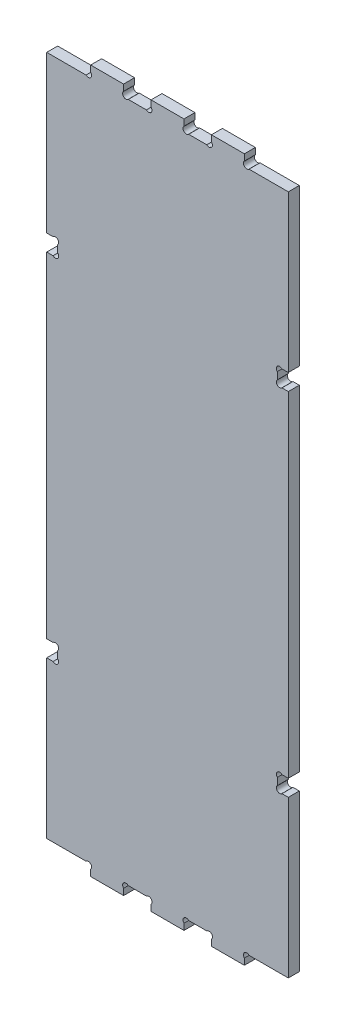
from build123d import *

# Parameters (mm, degrees)
SKETCH3_W           = 220
SKETCH3_H           = 640
BOSS_EXTRUDE1_DEPTH = 10
SKETCH4_W           = 40
SKETCH4_H           = 10
SKETCH4_W_2         = 25
CUT_EXTRUDE1_DEPTH  = 18
CAVITY1_START       = -75.965089032
CAVITY1_OUTLINE_W   = 10
CAVITY1_OUTLINE_H   = 10
CAVITY1_DEPTH       = 15
CAVITY1_START_2     = 244.034910968
CAVITY1_2_OUTLINE_W = 10
CAVITY1_2_OUTLINE_H = 10
CAVITY1_2_DEPTH     = 15
SKETCH7_R           = 3
CUT_EXTRUDE4_DEPTH  = 10


# Read off the part's stored shape, not the designer's step: Cavity1
with BuildPart() as part:
    # Sketch3 → Boss-Extrude1 (new body)
    with BuildSketch(Plane.XY):
        with Locations((-138.639194455, 91.534910968)):
            Rectangle(SKETCH3_W, SKETCH3_H)
    extrude(amount=BOSS_EXTRUDE1_DEPTH)

    # Sketch4 → Cut-Extrude1 (cut)
    with BuildSketch(Plane.XY.offset(10)):
        with Locations((-228.639194455, 406.534910968)):
            Rectangle(SKETCH4_W, SKETCH4_H)
        with Locations((-166.139194455, 406.534910968)):
            Rectangle(SKETCH4_W_2, SKETCH4_H)
        with Locations((-111.139194455, 406.534910968)):
            Rectangle(SKETCH4_W_2, SKETCH4_H)
        with Locations((-48.639194455, 406.534910968)):
            Rectangle(SKETCH4_W, SKETCH4_H)
        with Locations((-48.639194455, -223.465089032)):
            Rectangle(SKETCH4_W, SKETCH4_H)
        with Locations((-111.139194455, -223.465089032)):
            Rectangle(SKETCH4_W_2, SKETCH4_H)
        with Locations((-166.139194455, -223.465089032)):
            Rectangle(SKETCH4_W_2, SKETCH4_H)
        with Locations((-228.639194455, -223.465089032)):
            Rectangle(SKETCH4_W, SKETCH4_H)
    extrude(amount=-CUT_EXTRUDE1_DEPTH, mode=Mode.SUBTRACT)

    # Cavity1 outline → Cavity1 (cut)
    with BuildSketch(Plane(origin=(0, 0, 0), x_dir=(1, 0, 0), z_dir=(0, 1, 0)).offset(CAVITY1_START)):
        with Locations((-33.639194455, -5)):
            Rectangle(CAVITY1_OUTLINE_W, CAVITY1_OUTLINE_H)
        with Locations((-243.639194455, -5)):
            Rectangle(CAVITY1_OUTLINE_W, CAVITY1_OUTLINE_H)
    extrude(amount=CAVITY1_DEPTH, mode=Mode.SUBTRACT)

    # Cavity1 2 outline → Cavity1 2 (cut)
    with BuildSketch(Plane(origin=(0, 0, 0), x_dir=(1, 0, 0), z_dir=(0, 1, 0)).offset(CAVITY1_START_2)):
        with Locations((-33.639194455, -5)):
            Rectangle(CAVITY1_2_OUTLINE_W, CAVITY1_2_OUTLINE_H)
        with Locations((-243.639194455, -5)):
            Rectangle(CAVITY1_2_OUTLINE_W, CAVITY1_2_OUTLINE_H)
    extrude(amount=CAVITY1_2_DEPTH, mode=Mode.SUBTRACT)

    # Sketch7 → Cut-Extrude4 (cut)
    with BuildSketch(Plane(origin=(0, 0, 0), x_dir=(-1, 0, 0), z_dir=(0, 0, -1))):
        with Locations((36.517874112, -63.086409375)):
            Circle(SKETCH7_R)
        with Locations((36.517874112, -73.843768688)):
            Circle(SKETCH7_R)
        with Locations((240.760514799, -63.086409375)):
            Circle(SKETCH7_R)
        with Locations((240.760514799, -73.843768688)):
            Circle(SKETCH7_R)
        with Locations((240.760514799, 256.913590625)):
            Circle(SKETCH7_R)
        with Locations((240.760514799, 246.156231312)):
            Circle(SKETCH7_R)
        with Locations((36.517874112, 256.913590625)):
            Circle(SKETCH7_R)
        with Locations((36.517874112, 246.156231312)):
            Circle(SKETCH7_R)
        with Locations((121.517874112, 403.656231312)):
            Circle(SKETCH7_R)
        with Locations((66.517874112, 403.656231312)):
            Circle(SKETCH7_R)
        with Locations((100.760514799, 403.656231312)):
            Circle(SKETCH7_R)
        with Locations((210.760514799, 403.656231312)):
            Circle(SKETCH7_R)
        with Locations((155.760514799, 403.656231312)):
            Circle(SKETCH7_R)
        with Locations((176.517874112, 403.656231312)):
            Circle(SKETCH7_R)
        with Locations((121.517874112, -220.586409375)):
            Circle(SKETCH7_R)
        with Locations((66.517874112, -220.586409375)):
            Circle(SKETCH7_R)
        with Locations((100.760514799, -220.586409375)):
            Circle(SKETCH7_R)
        with Locations((155.760514799, -220.586409375)):
            Circle(SKETCH7_R)
        with Locations((176.517874112, -220.586409375)):
            Circle(SKETCH7_R)
        with Locations((210.760514799, -220.586409375)):
            Circle(SKETCH7_R)
    extrude(amount=-CUT_EXTRUDE4_DEPTH, mode=Mode.SUBTRACT)


solid = part.part
